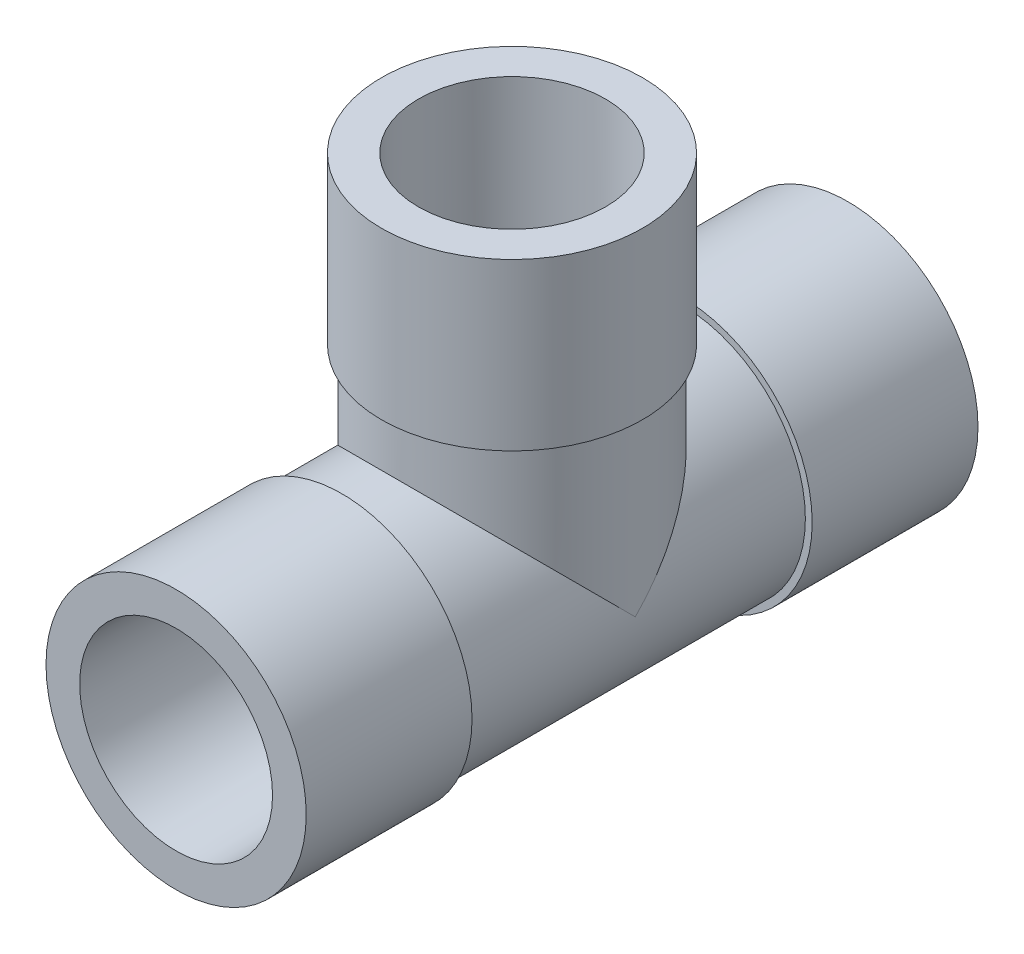
from build123d import *

# Parameters (mm, degrees)
SKETCH1_R                = 14.5
SKETCH1_R_2              = 10.5
BOSS_EXTRUDE1_DEPTH      = 20
SKETCH2_R                = 15.3
SKETCH2_R_2              = 11
BOSS_EXTRUDE2_DEPTH      = 19.5
DRAFT1_ANGLE             = 1
BOSS_EXTRUDE3_REACH      = 71.659
BOSS_EXTRUDE3_END_RADIUS = 14.5
SKETCH4_R                = 14.5
SKETCH5_R                = 15.35
BOSS_EXTRUDE4_DEPTH      = 19.5
SKETCH6_R                = 11
CUT_EXTRUDE1_DEPTH       = 40


# Read off the part's stored shape, not the designer's step: Mirror1
with BuildPart() as part:
    # Sketch1 → Boss-Extrude1 (new, symmetric)
    with BuildSketch(Plane.XY):
        Circle(SKETCH1_R)
        Circle(SKETCH1_R_2, mode=Mode.SUBTRACT)
    extrude(amount=BOSS_EXTRUDE1_DEPTH, both=True)

    # Sketch2 → Boss-Extrude2 (add)
    with BuildSketch(Plane.XY.offset(20)):
        Circle(SKETCH2_R)
        Circle(SKETCH2_R_2, mode=Mode.SUBTRACT)
    extrude(amount=BOSS_EXTRUDE2_DEPTH)

    # Draft1
    draft1_faces = [part.faces().sort_by_distance(p)[0] for p in [
        (-11, 0, 29.75),
    ]]
    draft(draft1_faces, Plane.XY.offset(20), DRAFT1_ANGLE)

    # Mirror1 outline → Mirror1 (revolve)
    with BuildSketch(Plane.XZ):
        Polygon((15.3, -39.5), (15.3, -20), (10.5, -20), (10.5, -8.644980815), (9.961423637, -39.5), align=None)
    revolve(axis=Axis((0, 0, 0), (0, 0, 1)))

    # Boss-Extrude3: up to this cylinder (the profile starts outside it)
    boss_extrude3_end = Plane(origin=(0, 0, 0), z_dir=(0, 0, -1)) * Cylinder(BOSS_EXTRUDE3_END_RADIUS, 173.318, mode=Mode.PRIVATE)
    # Sketch4 → Boss-Extrude3 (add, up to the surface)
    with BuildSketch(Plane(origin=(0, 40, 0), x_dir=(1, 0, 0), z_dir=(0, 1, 0)), mode=Mode.PRIVATE) as boss_extrude3_sk1:
        with Locations(Location((0, 0, 0), (0, 0, 270))):
            Circle(SKETCH4_R)
    boss_extrude3_tool1 = extrude(boss_extrude3_sk1.sketch, amount=-BOSS_EXTRUDE3_REACH, mode=Mode.PRIVATE) - boss_extrude3_end
    add(boss_extrude3_tool1.solids().sort_by_distance((0, 40, 0))[0])

    # Sketch5 → Boss-Extrude4 (add)
    with BuildSketch(Plane(origin=(0, 40, 0), x_dir=(1, 0, 0), z_dir=(0, 1, 0))):
        with Locations(Location((0, 0, 0), (0, 0, 270))):
            Circle(SKETCH5_R)
    extrude(amount=-BOSS_EXTRUDE4_DEPTH)

    # Sketch6 → Cut-Extrude1 (cut)
    with BuildSketch(Plane(origin=(0, 40, 0), x_dir=(1, 0, 0), z_dir=(0, 1, 0))):
        with Locations(Location((0, 0, 0), (0, 0, 270))):
            Circle(SKETCH6_R)
    extrude(amount=-CUT_EXTRUDE1_DEPTH, mode=Mode.SUBTRACT)


solid = part.part
